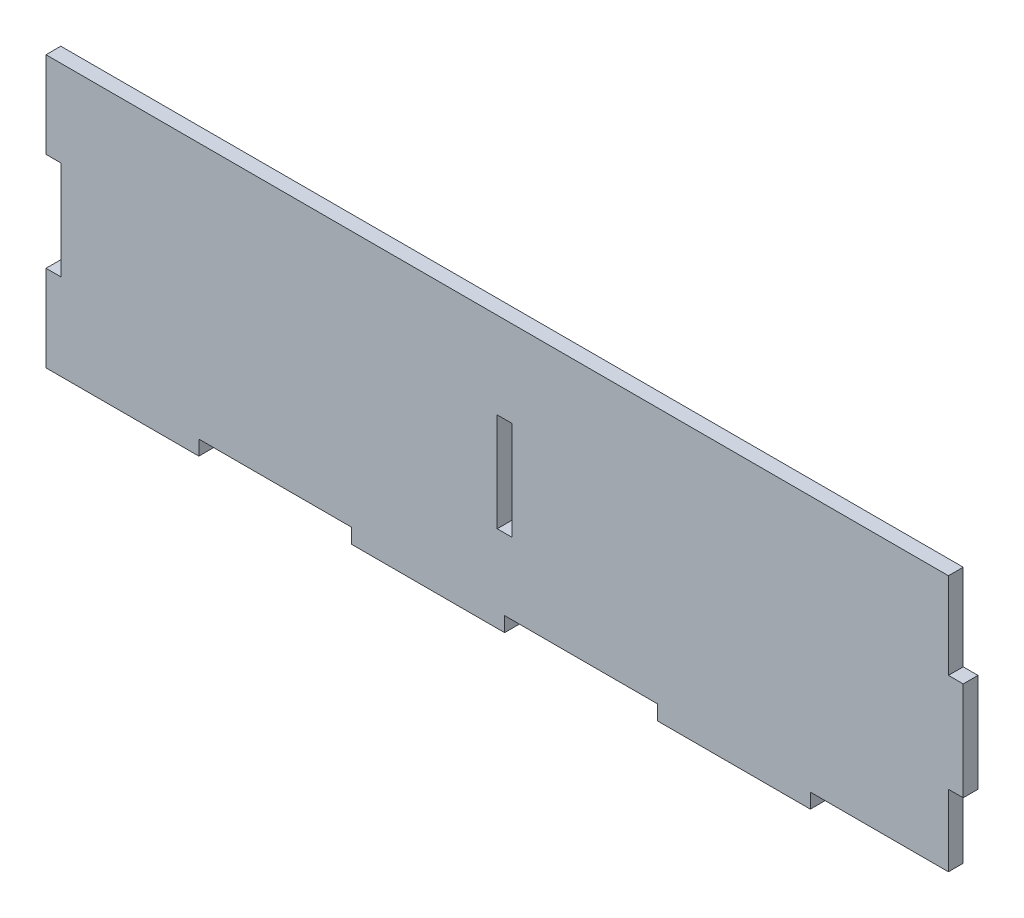
from build123d import *

# Parameters (mm, degrees)
SKETCH1_W           = 3
SKETCH1_H           = 20
BOSS_EXTRUDE1_DEPTH = 3


with BuildPart() as part:
    # Sketch1 → Boss-Extrude1 (new body)
    with BuildSketch(Plane.XY):
        Polygon((-93, 27.5), (-93, 10), (-90, 10), (-90, -10), (-93, -10), (-93, -27.5), (-62, -27.5), (-62, -24.5), (-31, -24.5), (-31, -27.5), (0, -27.5), (0, -24.5), (31, -24.5), (31, -27.5), (62, -27.5), (62, -24.5), (90, -24.5), (90, -10), (93, -10), (93, 10), (90, 10), (90, 27.5), align=None)
        Rectangle(SKETCH1_W, SKETCH1_H, mode=Mode.SUBTRACT)
    extrude(amount=BOSS_EXTRUDE1_DEPTH)


solid = part.part
